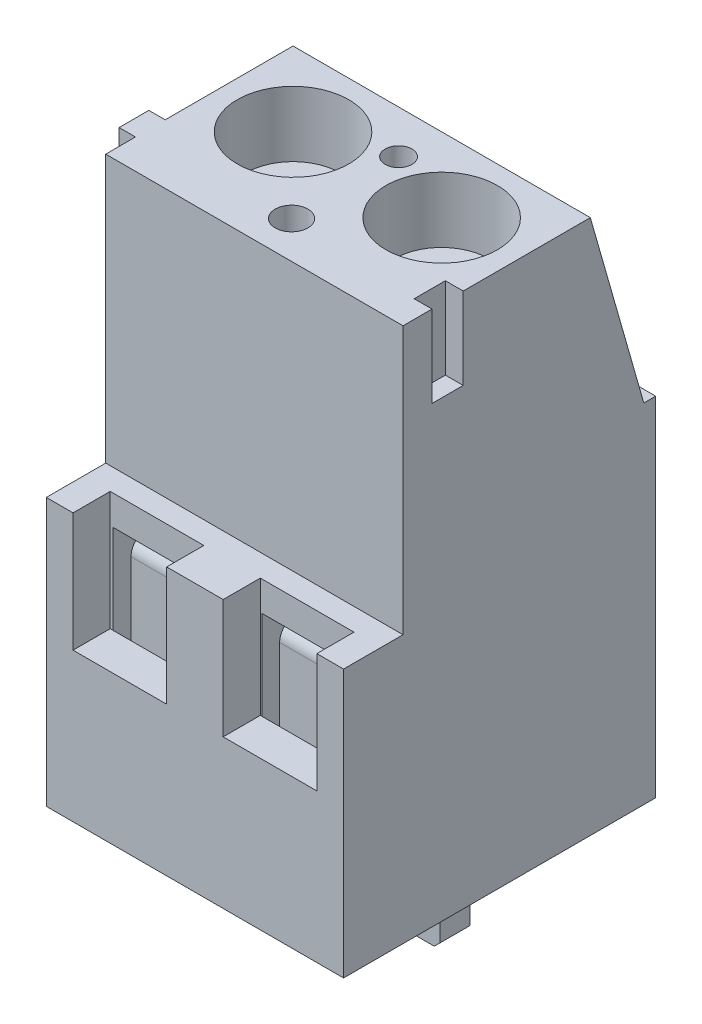
from build123d import *

# Parameters (mm, degrees)
BOSS_EXTRUDE1_DEPTH = 5
SKETCH2_R           = 1.875
CUT_EXTRUDE1_DEPTH  = 3.25
SKETCH3_R           = 1.75
BOSS_EXTRUDE2_DEPTH = 1.25
CHAMFER1_SIZE       = 0.15
CUT_EXTRUDE2_DEPTH  = 0.5
SKETCH5_W           = 3
SKETCH5_H           = 5
CUT_EXTRUDE3_DEPTH  = 9.25
CHAMFER2_SIZE       = 0.5
SKETCH6_W           = 3.15
SKETCH6_H           = 1.25
CUT_EXTRUDE4_DEPTH  = 4
SKETCH7_W           = 0.55
SKETCH7_H           = 1
BOSS_EXTRUDE3_DEPTH = 2.75
SKETCH8_W           = 0.6
SKETCH8_H           = 1.05
CUT_EXTRUDE5_DEPTH  = 2.75
SKETCH9_R           = 0.55
SKETCH9_R_2         = 0.45
CUT_EXTRUDE6_DEPTH  = 2
EXTRUDE_THIN1_START = -3.95
EXTRUDE_THIN1_DEPTH = 2.9
CUT_EXTRUDE7_DEPTH  = 20.846032349


# Read off the part's stored shape, not the designer's step: Extrude-Thin1
with BuildPart() as part:
    # Sketch1 → Boss-Extrude1 (new, symmetric)
    with BuildSketch(Plane(origin=(0, 0, 0), x_dir=(0, 0, -1), z_dir=(1, 0, 0))):
        Polygon((-3.25, 18), (3.05, 18), (4.85, 11.7), (5.25, 11.7), (5.25, 0), (-5.25, 0), (-5.25, 9), (-3.25, 9), align=None)
    extrude(amount=BOSS_EXTRUDE1_DEPTH, both=True)

    # Sketch2 → Cut-Extrude1 (cut)
    with BuildSketch(Plane(origin=(0, 18, 0), x_dir=(1, 0, 0), z_dir=(0, 1, 0))):
        with Locations(Location((-2.5, 0.55, 0), (0, 0, 270))):
            Circle(SKETCH2_R)
        with Locations(Location((2.5, 0.55, 0), (0, 0, 270))):
            Circle(SKETCH2_R)
    extrude(amount=-CUT_EXTRUDE1_DEPTH, mode=Mode.SUBTRACT)

    # Sketch3 → Boss-Extrude2 (add)
    with BuildSketch(Plane(origin=(0, 14.75, 0), x_dir=(1, 0, 0), z_dir=(0, 1, 0))):
        with Locations(Location((-2.5, 0.55, 0), (0, 0, 270))):
            Circle(SKETCH3_R)
        with Locations(Location((2.5, 0.55, 0), (0, 0, 90))):
            Circle(SKETCH3_R)
    extrude(amount=BOSS_EXTRUDE2_DEPTH)

    # Chamfer1
    chamfer1_edges = [part.edges().sort_by_distance(p)[0] for p in [
        (-2.5, 16, -2.3),
        (2.5, 16, 1.2),
    ]]
    chamfer(chamfer1_edges, length=CHAMFER1_SIZE)

    # Sketch4 → Cut-Extrude2 (cut)
    with BuildSketch(Plane(origin=(0, 16, 0), x_dir=(1, 0, 0), z_dir=(0, 1, 0))):
        Polygon((-4.263049218, 0.242132407), (-3.982094273, -0.453255484), (-0.736950782, 0.857867593), (-1.017905727, 1.553255484), align=None)
        Polygon((1.017905727, -0.453255484), (4.263049218, 0.857867593), (3.982094273, 1.553255484), (0.736950782, 0.242132407), align=None)
    extrude(amount=-CUT_EXTRUDE2_DEPTH, mode=Mode.SUBTRACT)

    # Sketch5 → Cut-Extrude3 (cut)
    with BuildSketch(Plane(origin=(0, 0, -5.25), x_dir=(-1, 0, 0), z_dir=(0, 0, -1))):
        with Locations((-2.5, 5.5)):
            Rectangle(SKETCH5_W, SKETCH5_H)
        with Locations((2.5, 5.5)):
            Rectangle(SKETCH5_W, SKETCH5_H)
    extrude(amount=-CUT_EXTRUDE3_DEPTH, mode=Mode.SUBTRACT)

    # Chamfer2
    chamfer2_edges = [part.edges().sort_by_distance(p)[0] for p in [
        (4, 5.5, -5.25),
        (2.5, 3, -5.25),
        (1, 5.5, -5.25),
        (2.5, 8, -5.25),
        (-2.5, 8, -5.25),
        (-1, 5.5, -5.25),
        (-2.5, 3, -5.25),
        (-4, 5.5, -5.25),
    ]]
    chamfer(chamfer2_edges, length=CHAMFER2_SIZE)

    # Sketch6 → Cut-Extrude4 (cut)
    with BuildSketch(Plane(origin=(0, 9, 0), x_dir=(1, 0, 0), z_dir=(0, 1, 0))):
        with Locations((2.525, -4.625)):
            Rectangle(SKETCH6_W, SKETCH6_H)
        with Locations((-2.525, -4.625)):
            Rectangle(SKETCH6_W, SKETCH6_H)
    extrude(amount=-CUT_EXTRUDE4_DEPTH, mode=Mode.SUBTRACT)

    # Sketch7 → Boss-Extrude3 (add)
    with BuildSketch(Plane(origin=(0, 18, 0), x_dir=(1, 0, 0), z_dir=(0, 1, 0))):
        with Locations((-5.275, -1.75)):
            Rectangle(SKETCH7_W, SKETCH7_H)
    extrude(amount=-BOSS_EXTRUDE3_DEPTH)

    # Sketch8 → Cut-Extrude5 (cut)
    with BuildSketch(Plane(origin=(0, 18, 0), x_dir=(1, 0, 0), z_dir=(0, 1, 0))):
        with Locations((4.7, -1.75)):
            Rectangle(SKETCH8_W, SKETCH8_H)
    extrude(amount=-CUT_EXTRUDE5_DEPTH, mode=Mode.SUBTRACT)

    # Sketch9 → Cut-Extrude6 (cut)
    with BuildSketch(Plane(origin=(0, 18, 0), x_dir=(1, 0, 0), z_dir=(0, 1, 0))):
        with Locations(Location((0, -2, 0), (0, 0, 270))):
            Circle(SKETCH9_R)
        with Locations(Location((0, 1.6, 0), (0, 0, 270))):
            Circle(SKETCH9_R_2)
    extrude(amount=-CUT_EXTRUDE6_DEPTH, mode=Mode.SUBTRACT)


with BuildPart() as body_2:
    # Extrude-Thin1 outline → Extrude-Thin1 (new body)
    with BuildSketch(Plane(origin=(0, 0, 0), x_dir=(0, 0, -1), z_dir=(1, 0, 0)).offset(EXTRUDE_THIN1_START)):
        with BuildLine():
            Line((1.795768571, 6.05), (-1.4, 6.05))
            Line((-1.4, 6.05), (-1.95, 5.6))
            ThreePointArc((-1.95, 5.6), (-1.78890873, 5.21109127), (-1.4, 5.05))
            Line((-1.4, 5.05), (1.947963792, 5.05))
            ThreePointArc((1.947963792, 5.05), (2.124174849, 5.078991686), (2.281808976, 5.162910315))
            Line((2.281808976, 5.162910315), (3.983845184, 6.462910315))
            ThreePointArc((3.983845184, 6.462910315), (4.171008314, 7.076211057), (3.65, 7.45))
            Line((3.65, 7.45), (-2.9, 7.45))
            ThreePointArc((-2.9, 7.45), (-3.28890873, 7.28890873), (-3.45, 6.9))
            Line((-3.45, 6.9), (-3.45, 4.1))
            ThreePointArc((-3.45, 4.1), (-3.28890873, 3.71109127), (-2.9, 3.55))
            Line((-2.9, 3.55), (-0.55, 3.55))
            ThreePointArc((-0.55, 3.55), (-0.16109127, 3.38890873), (0, 3))
            Line((0, 3), (0, -2.8))
            Line((0, -2.8), (1, -2.8))
            Line((1, -2.8), (1, 3))
            ThreePointArc((1, 3), (0.546015511, 4.096015511), (-0.55, 4.55))
            Line((-0.55, 4.55), (-2.45, 4.55))
            Line((-2.45, 4.55), (-2.45, 6.45))
            Line((-2.45, 6.45), (2.31947202, 6.45))
            Line((2.31947202, 6.45), (1.795768571, 6.05))
        make_face()
    extrude(amount=EXTRUDE_THIN1_DEPTH)

    # Sketch11 → Cut-Extrude7 (cut, through all)
    with BuildSketch(Plane(origin=(0, 0, -1), x_dir=(-1, 0, 0), z_dir=(0, 0, -1))):
        Polygon((1.05, 3), (2, 3), (2, -2.6), (2.2, -2.8), (1.05, -2.8), align=None)
        Polygon((2.8, -2.8), (3, -2.6), (3, 3), (3.95, 3), (3.95, -2.8), align=None)
    extrude(amount=-CUT_EXTRUDE7_DEPTH, mode=Mode.SUBTRACT)


with BuildPart() as body_3:
    # Mirror1: mirrored copy
    add(body_2.part.mirror(Plane(origin=(0, 0, 0), x_dir=(0, 0, 1), z_dir=(1, 0, 0))))


solid = Compound([part.part, body_2.part, body_3.part])
